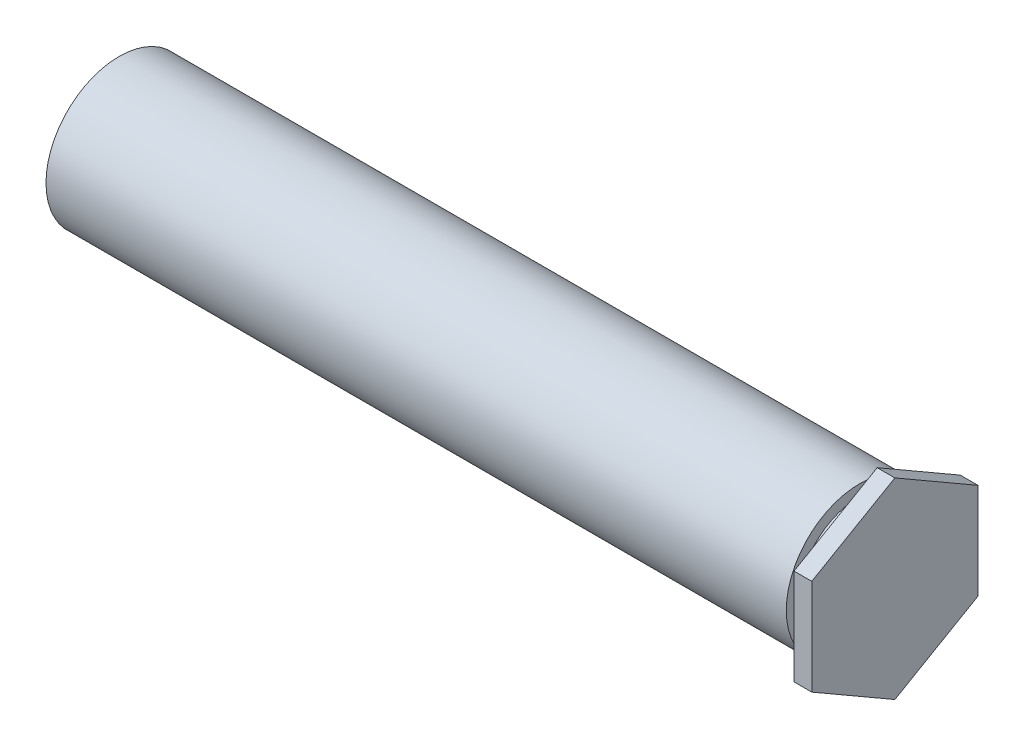
from build123d import *

# Parameters (mm, degrees)
SKETCH2_R      = 2.0955
EXTRUDE1_DEPTH = 22.225
EXTRUDE2_DEPTH = 0.508
EXTRUDE3_START = 0.508
SKETCH4_R      = 2.0955
SKETCH4_R_2    = 1.778
EXTRUDE3_DEPTH = 0.508
SKETCH5_R      = 1.4224
EXTRUDE4_DEPTH = 9.525
SWEEP1_PITCH   = 0.635
SKETCH8_R      = 1.4732
EXTRUDE6_DEPTH = 23.520689273


with BuildPart() as part:
    # Sketch2 → Extrude1 (new body)
    with BuildSketch(Plane(origin=(-11.1125, 0, 0), x_dir=(0, 0, -1), z_dir=(1, 0, 0))):
        Circle(SKETCH2_R)
    extrude(amount=EXTRUDE1_DEPTH)

    # Sketch3 → Extrude2 (add)
    with BuildSketch(Plane(origin=(11.1125, 0, 0), x_dir=(0, 0, -1), z_dir=(1, 0, 0))):
        Polygon((0, 2.749630657), (-2.38125, 1.374815329), (-2.38125, -1.374815329), (0, -2.749630657), (2.38125, -1.374815329), (2.38125, 1.374815329), align=None)
    extrude(amount=-EXTRUDE2_DEPTH)

    # Sketch4 → Extrude3 (cut)
    with BuildSketch(Plane.ZY.offset(-10.6045).offset(EXTRUDE3_START)):
        Circle(SKETCH4_R)
        Circle(SKETCH4_R_2, mode=Mode.SUBTRACT)
    extrude(amount=-EXTRUDE3_DEPTH, mode=Mode.SUBTRACT)

    # Sketch5 → Extrude4 (cut)
    with BuildSketch(Plane.ZY.offset(11.1125)):
        Circle(SKETCH5_R)
    extrude(amount=-EXTRUDE4_DEPTH, mode=Mode.SUBTRACT)

    # Sweep1: the profile of Sketch7 profile screwed along a right-hand helix of 15 turns, 6 arcs to a turn; built about Z, then put on its axis
    sweep1_z = Axis((0, 0, 0), (0, 0, 1))
    sweep1_corners = [(1.4227, 0, -0.555798205), (1.4227, 0, 0.000173205), (1.009955401, 0, -0.238125), (1.009955401, 0, -0.3175)]
    with BuildLine(mode=Mode.PRIVATE) as sweep1_profile:
        Line(sweep1_corners[0], sweep1_corners[1])
        Line(sweep1_corners[1], sweep1_corners[2])
        Line(sweep1_corners[2], sweep1_corners[3])
        Line(sweep1_corners[3], sweep1_corners[0])
    sweep1_cap = Face(sweep1_profile.wire())
    sweep1_turn_angles = [0, 30, 60, 90, 120, 150, 180, 210, 240, 270, 300, 330, 360]
    sweep1_turn_weights = [1, 0.8660254037844387, 1, 0.8660254037844387, 1, 0.8660254037844387, 1, 0.8660254037844387, 1, 0.8660254037844387, 1, 0.8660254037844387, 1]
    sweep1_turn_rails = [Edge.make_bspline([Vector(p[0], p[1], 0).rotate(sweep1_z, sweep1_turn_angles[k]) / sweep1_turn_weights[k] + Vector(0, 0, p[2] + SWEEP1_PITCH * sweep1_turn_angles[k] / 360) for k in range(13)], [0, 0, 0, 1, 1, 2, 2, 3, 3, 4, 4, 5, 5, 6, 6, 6], 2, sweep1_turn_weights) for p in sweep1_corners]
    sweep1_turn_sides = [Face.make_surface_from_curves(sweep1_turn_rails[p[0]], sweep1_turn_rails[p[1]]) for p in [(0, 1), (1, 2), (2, 3), (3, 0)]]
    sweep1 = Plane(origin=(-11.1125, 0, 0), x_dir=(0, 1, 0), z_dir=(1, 0, 0)) * Solid(Shell([*[p.moved(Location((0, 0, SWEEP1_PITCH * i))) for i in range(15) for p in sweep1_turn_sides], sweep1_cap, sweep1_cap.rotate(sweep1_z, 5400).moved(Location((0, 0, SWEEP1_PITCH * 5400 / 360)))]))
    add(sweep1)

    # Sketch8 → Extrude6 (cut)
    with BuildSketch(Plane.ZY.offset(11.1125)):
        Circle(SKETCH8_R)
    extrude(amount=EXTRUDE6_DEPTH, mode=Mode.SUBTRACT)

    # Extrude6 cone 1 section (through the dimple's axis) → Extrude6 other way (revolve, cut)
    with BuildSketch(Plane(origin=(-11.1125, 0, 0), x_dir=(0, 0, 1), z_dir=(0, 1, 0))):
        Polygon((0, 0), (1.4732, 0), (0, 1.4732), align=None)
    revolve(axis=Axis((-11.1125, 0, 0), (1, 0, 0)), mode=Mode.SUBTRACT)


solid = part.part
